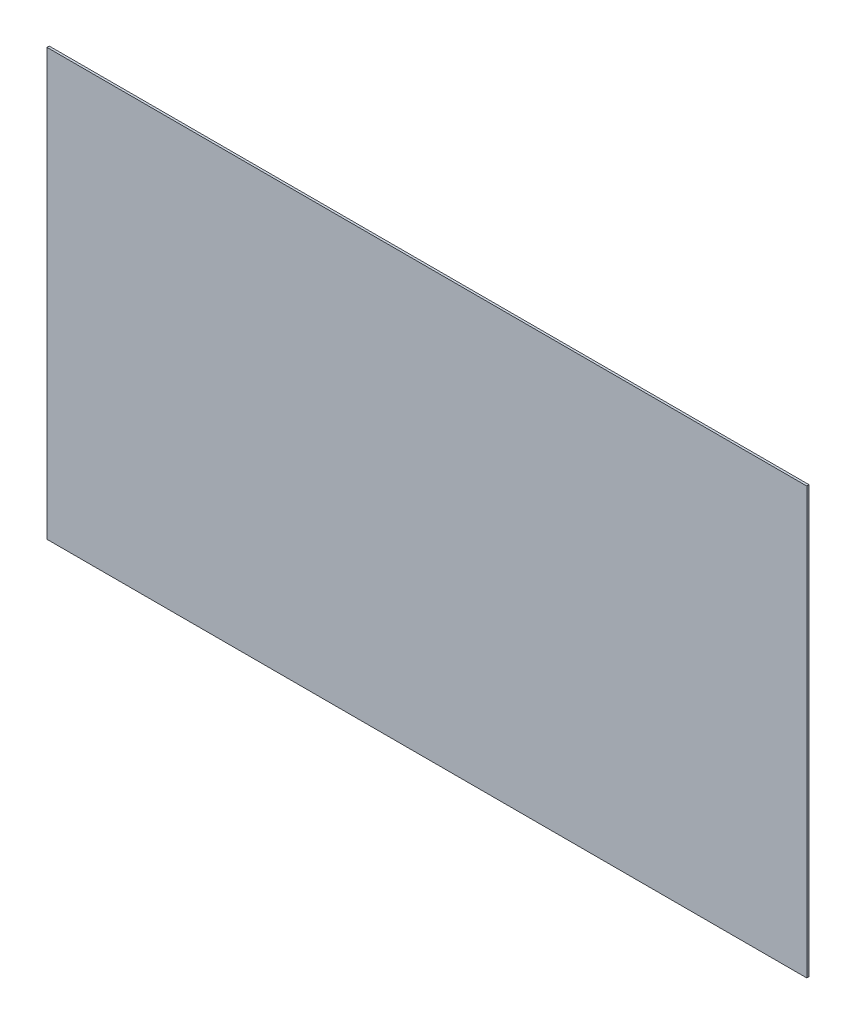
from build123d import *

# Parameters (mm, degrees)
SKETCH2_W           = 100000
SKETCH2_H           = 56073.820081106
BOSS_EXTRUDE1_DEPTH = 300


with BuildPart() as part:
    # Sketch2 → Boss-Extrude1 (new body)
    with BuildSketch(Plane.XY):
        with Locations((50000, 28036.910040553)):
            Rectangle(SKETCH2_W, SKETCH2_H)
    extrude(amount=BOSS_EXTRUDE1_DEPTH)


solid = part.part
